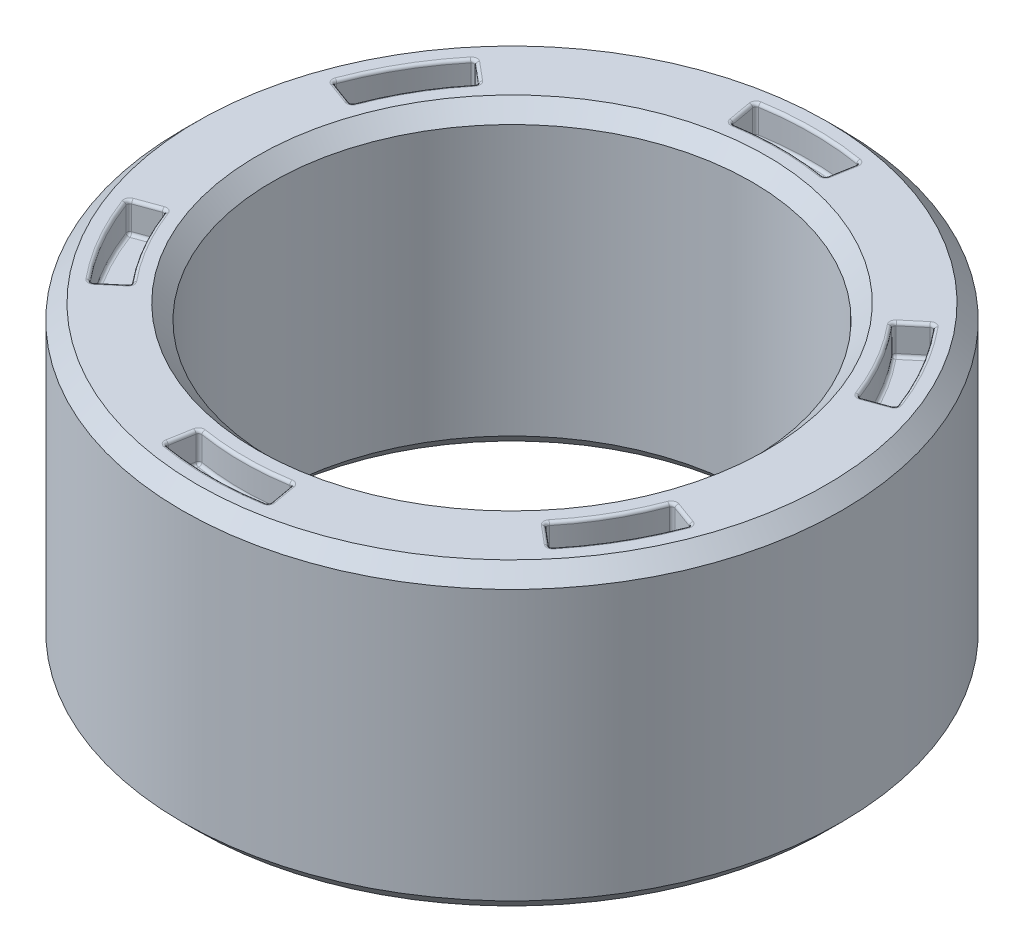
from build123d import *

# Parameters (mm, degrees)
SKETCH1_R                = 11
SKETCH1_R_2              = 8
BOSS_EXTRUDE1_DEPTH      = 10
CHAMFER1_SIZE            = 0.5
CUT_EXTRUDE1_DEPTH       = 1
FILLET1_R                = 0.1
CIRPATTERN1_COUNT        = 6
FILLET1_OF_CIRPATTERN1_R = 0.1


with BuildPart() as part:
    # Sketch1 → Boss-Extrude1 (new body)
    with BuildSketch(Plane(origin=(0, 0, 0), x_dir=(1, 0, 0), z_dir=(0, 1, 0))):
        Circle(SKETCH1_R)
        Circle(SKETCH1_R_2, mode=Mode.SUBTRACT)
    extrude(amount=BOSS_EXTRUDE1_DEPTH)

    # Chamfer1
    chamfer1_edges = [part.edges().sort_by_distance(p)[0] for p in [
        (-8, 0, 0),
        (-11, 0, 0),
        (-11, 10, 0),
        (-8, 10, 0),
    ]]
    chamfer(chamfer1_edges, length=CHAMFER1_SIZE)

    # Sketch2 → Cut-Extrude1 (cut)
    with BuildSketch(Plane(origin=(0, 10, 0), x_dir=(1, 0, 0), z_dir=(0, 1, 0))):
        with BuildLine():
            Line((-1.562833599, 8.863269777), (-1.736481777, 9.84807753))
            ThreePointArc((-1.736481777, 9.84807753), (0, 10), (1.736481777, 9.84807753))
            Line((1.736481777, 9.84807753), (1.562833599, 8.863269777))
            ThreePointArc((1.562833599, 8.863269777), (0, 9), (-1.562833599, 8.863269777))
        make_face()
    cut_extrude1 = extrude(amount=-CUT_EXTRUDE1_DEPTH, mode=Mode.SUBTRACT)

    # Fillet1
    fillet1_edges = [part.edges().sort_by_distance(p)[0] for p in [
        (1.562833599, 9.5, -8.863269777),
        (1.736481777, 9.5, -9.84807753),
        (1.649657688, 10, -9.355673654),
        (1.649657688, 9, -9.355673654),
        (-1.736481777, 9.5, -9.84807753),
        (-1.562833599, 9.5, -8.863269777),
        (-1.649657688, 10, -9.355673654),
        (-1.649657688, 9, -9.355673654),
        (0, 10, -9),
        (0, 9, -9),
        (0, 10, -10),
        (0, 9, -10),
    ]]
    fillet(fillet1_edges, radius=FILLET1_R)

    # CirPattern1: Cut-Extrude1 ×6 about axis
    cirpattern1_axis = Axis((0, 10, 0), (0, -1, 0))
    for i in range(1, CIRPATTERN1_COUNT):
        add(cut_extrude1.rotate(cirpattern1_axis, i * 360 / CIRPATTERN1_COUNT), mode=Mode.SUBTRACT)

    # Fillet1 of CirPattern1
    fillet1_of_cirpattern1_edges = [part.edges().sort_by_distance(p)[0] for p in [
        (8.457233587, 9.5, -3.07818129),
        (9.396926208, 9.5, -3.420201433),
        (8.927079897, 10, -3.249191362),
        (8.927079897, 9, -3.249191362),
        (7.660444431, 9.5, -6.427876097),
        (6.894399988, 9.5, -5.785088487),
        (7.27742221, 10, -6.106482292),
        (7.27742221, 9, -6.106482292),
        (7.794228634, 10, -4.5),
        (7.794228634, 9, -4.5),
        (8.660254038, 10, -5),
        (8.660254038, 9, -5),
        (6.894399988, 9.5, 5.785088487),
        (7.660444431, 9.5, 6.427876097),
        (7.27742221, 10, 6.106482292),
        (7.27742221, 9, 6.106482292),
        (9.396926208, 9.5, 3.420201433),
        (8.457233587, 9.5, 3.07818129),
        (8.927079897, 10, 3.249191362),
        (8.927079897, 9, 3.249191362),
        (7.794228634, 10, 4.5),
        (7.794228634, 9, 4.5),
        (8.660254038, 10, 5),
        (8.660254038, 9, 5),
        (-1.562833599, 9.5, 8.863269777),
        (-1.736481777, 9.5, 9.84807753),
        (-1.649657688, 10, 9.355673654),
        (-1.649657688, 9, 9.355673654),
        (1.736481777, 9.5, 9.84807753),
        (1.562833599, 9.5, 8.863269777),
        (1.649657688, 10, 9.355673654),
        (1.649657688, 9, 9.355673654),
        (0, 10, 9),
        (0, 9, 9),
        (0, 10, 10),
        (0, 9, 10),
        (-8.457233587, 9.5, 3.07818129),
        (-9.396926208, 9.5, 3.420201433),
        (-8.927079897, 10, 3.249191362),
        (-8.927079897, 9, 3.249191362),
        (-7.660444431, 9.5, 6.427876097),
        (-6.894399988, 9.5, 5.785088487),
        (-7.27742221, 10, 6.106482292),
        (-7.27742221, 9, 6.106482292),
        (-7.794228634, 10, 4.5),
        (-7.794228634, 9, 4.5),
        (-8.660254038, 10, 5),
        (-8.660254038, 9, 5),
        (-6.894399988, 9.5, -5.785088487),
        (-7.660444431, 9.5, -6.427876097),
        (-7.27742221, 10, -6.106482292),
        (-7.27742221, 9, -6.106482292),
        (-9.396926208, 9.5, -3.420201433),
        (-8.457233587, 9.5, -3.07818129),
        (-8.927079897, 10, -3.249191362),
        (-8.927079897, 9, -3.249191362),
        (-7.794228634, 10, -4.5),
        (-7.794228634, 9, -4.5),
        (-8.660254038, 10, -5),
        (-8.660254038, 9, -5),
    ]]
    fillet(fillet1_of_cirpattern1_edges, radius=FILLET1_OF_CIRPATTERN1_R)


solid = part.part
